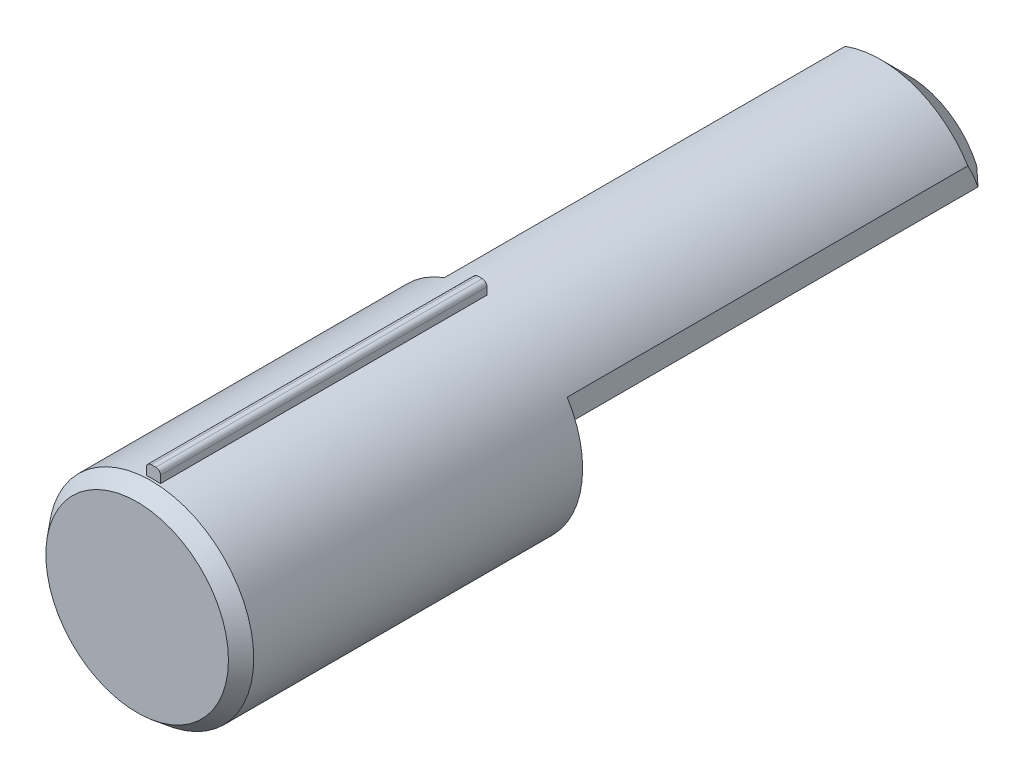
from build123d import *

# Parameters (mm, degrees)
SKETCH14_R           = 11
BOSS_EXTRUDE7_DEPTH  = 36.75
SKETCH18_W           = 7.62
SKETCH18_H           = 4.5
BOSS_EXTRUDE9_DEPTH  = 45.94
CUT_EXTRUDE16_REACH  = 87.359
LPATTERN1_COUNT      = 17
LPATTERN1_PITCH      = 2.7
BOSS_EXTRUDE10_DEPTH = 45.94
CHAMFER2_SIZE        = 1.5
CHAMFER2_SIZE2       = 1.21467605
BOSS_EXTRUDE11_DEPTH = 45.94
BOSS_EXTRUDE12_DEPTH = 2.5
BOSS_EXTRUDE14_START = -35
BOSS_EXTRUDE14_DEPTH = 35
FILLET2_R            = 0.5


with BuildPart() as part:
    # Sketch14 → Boss-Extrude7 (new body)
    with BuildSketch(Plane.XY):
        with Locations((-43.416294802, -3.957587863)):
            Circle(SKETCH14_R)
    extrude(amount=-BOSS_EXTRUDE7_DEPTH)

    # Sketch18 → Boss-Extrude9 (add)
    with BuildSketch(Plane(origin=(0, 0, -36.75), x_dir=(-1, 0, 0), z_dir=(0, 0, -1))):
        with Locations((43.416294802, 4.092412137)):
            Rectangle(SKETCH18_W, SKETCH18_H)
    extrude(amount=BOSS_EXTRUDE9_DEPTH)

    # Sketch19 → Cut-Extrude16 (cut, up to next)
    with BuildSketch(Plane.ZY.offset(47.409754566), mode=Mode.PRIVATE) as cut_extrude16_sk1:
        with BuildLine():
            Line((-81.573331938, 3.757468407), (-80.99640478, 3.757468407))
            ThreePointArc((-80.99640478, 3.757468407), (-80.773630162, 3.685551679), (-80.634956444, 3.496951186))
            Line((-80.634956444, 3.496951186), (-80.052462184, 1.749468407))
            Line((-80.052462184, 1.749468407), (-82.517274534, 1.749468407))
            Line((-82.517274534, 1.749468407), (-81.934780275, 3.496951186))
            ThreePointArc((-81.934780275, 3.496951186), (-81.796106557, 3.685551679), (-81.573331938, 3.757468407))
        make_face()
    cut_extrude16_tool1 = extrude(cut_extrude16_sk1.sketch, amount=-CUT_EXTRUDE16_REACH, mode=Mode.PRIVATE) & part.part
    cut_extrude16 = cut_extrude16_tool1.solids().sort_by_distance((-47.409755, 2.620329, -81.284868))[0]
    add(cut_extrude16, mode=Mode.SUBTRACT)

    # LPattern1: Cut-Extrude16 ×17
    with Locations(*[(0, 0, i * LPATTERN1_PITCH) for i in range(1, LPATTERN1_COUNT)]):
        add(cut_extrude16, mode=Mode.SUBTRACT)

    # Sketch20 → Boss-Extrude10 (add)
    with BuildSketch(Plane(origin=(0, 0, -36.75), x_dir=(-1, 0, 0), z_dir=(0, 0, -1))):
        with BuildLine():
            Line((39.606294802, 6.342412137), (47.226294802, 6.342412137))
            Line((47.226294802, 6.342412137), (47.226294802, 6.36151578))
            ThreePointArc((47.226294802, 6.36151578), (43.416294802, 7.042412137), (39.606294802, 6.36151578))
            Line((39.606294802, 6.36151578), (39.606294802, 6.342412137))
        make_face()
    extrude(amount=BOSS_EXTRUDE10_DEPTH)

    # Chamfer1: read off the stored shape, not the designer's step
    # Chamfer1 outline → Chamfer1 (revolve, cut)
    with BuildSketch(Plane(origin=(-43.416294802, -3.957587863, 0), x_dir=(1, 0, 0), z_dir=(0, -1, 0))):
        Polygon((11.000000059, -82.589999941), (10.9, -82.69), (11.000000059, -82.69), align=None)
    revolve(axis=Axis((-43.416294802, -3.957587863, 0), (0, 0, 1)), mode=Mode.SUBTRACT)

    # Chamfer2
    chamfer2_edges = [part.edges().sort_by_distance(p)[0] for p in [
        (-54.416294802, -3.957587863, 0),
    ]]
    chamfer2_side = [part.faces().sort_by_distance(p)[0] for p in [
        (-54.416294802, -3.957587863, -18.375),
    ]]
    chamfer(chamfer2_edges, length=CHAMFER2_SIZE, length2=CHAMFER2_SIZE2, reference=chamfer2_side[0])

    # Sketch21 → Boss-Extrude11 (add)
    with BuildSketch(Plane(origin=(0, 0, -36.75), x_dir=(-1, 0, 0), z_dir=(0, 0, -1))):
        with BuildLine():
            Line((39.606294802, 1.842412137), (39.606294802, 6.36151578))
            ThreePointArc((39.606294802, 6.36151578), (36.46072284, 4.564150146), (34.069637646, 1.842412137))
            Line((34.069637646, 1.842412137), (39.606294802, 1.842412137))
        make_face()
    extrude(amount=BOSS_EXTRUDE11_DEPTH)

    # Sketch23 → Boss-Extrude12 (add)
    with BuildSketch(Plane.XZ.offset(-1.842412137)):
        Polygon((-39.606294802, -36.883443427), (-39.606294802, -36.75), (-34.069637646, -36.75), (-34.069637646, -82.69), (-39.606294802, -82.69), (-39.606294802, -82.486293291), align=None)
    extrude(amount=BOSS_EXTRUDE12_DEPTH)

    # Chamfer4: read off the stored shape, not the designer's step
    # Chamfer4 outline → Chamfer4 (revolve, cut)
    with BuildSketch(Plane(origin=(-43.416294802, -3.957587863, 0), x_dir=(1, 0, 0), z_dir=(0, -1, 0))):
        Polygon((7.999999773, -82.690000227), (11.000000044, -82.69000017), (11.000000035, -79.69), align=None)
    revolve(axis=Axis((-43.416294802, -3.957587863, 0), (0, 0, 1)), mode=Mode.SUBTRACT)

    # Sketch24 → Boss-Extrude14 (add)
    with BuildSketch(Plane(origin=(0, 0, -36.75), x_dir=(-1, 0, 0), z_dir=(0, 0, -1)).offset(BOSS_EXTRUDE14_START)):
        with BuildLine():
            Line((42.666294802, 7.016814171), (42.666294802, 8.292412137))
            Line((42.666294802, 8.292412137), (44.166294802, 8.292412137))
            Line((44.166294802, 8.292412137), (44.166294802, 7.016814171))
            ThreePointArc((44.166294802, 7.016814171), (43.416294802, 7.042412137), (42.666294802, 7.016814171))
        make_face()
    extrude(amount=BOSS_EXTRUDE14_DEPTH)

    # Fillet2
    fillet2_edges = [part.edges().sort_by_distance(p)[0] for p in [
        (-42.666294802, 8.292412137, -19.25),
        (-44.166294802, 8.292412137, -19.25),
    ]]
    fillet(fillet2_edges, radius=FILLET2_R)


solid = part.part
